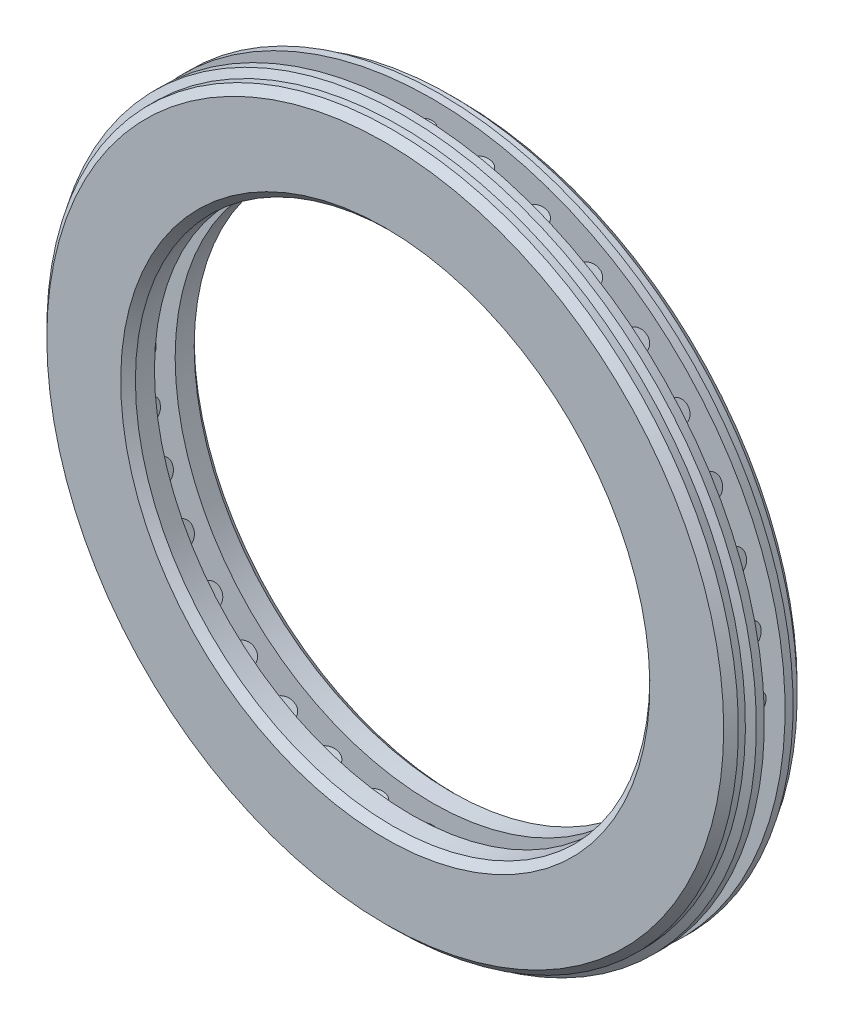
from build123d import *

# Parameters (mm, degrees)
BASESKE_W            = 1.428571429
BASESKE_H            = 7.8
CHAMFER1_SIZE        = 1
CIRPATTERNBALL_COUNT = 36


with BuildPart() as part:
    # BaseSke → Roller (revolve)
    with BuildSketch(Plane(origin=(0, 0, 0), x_dir=(0, 0, -1), z_dir=(1, 0, 0))):
        with Locations((-0.714285715, 41.5)):
            Rectangle(BASESKE_W, BASESKE_H)
    roller = revolve(axis=Axis((0, 129.521395432, 0), (0, -1, 0)))

    # ThrustPSke → ThrustPlates (revolve)
    with BuildSketch(Plane(origin=(0, 0, 0), x_dir=(0, 0, -1), z_dir=(1, 0, 0))):
        Polygon((-2.5, 48), (-1.408571429, 48), (-1.408571429, 35), (-5, 35), (-5, 47.054795131), (-3.045714286, 47.054795131), align=None)
        Polygon((5, 35), (1.408571429, 35), (1.408571429, 48), (2.5, 48), (3.045714286, 47.054795131), (5, 47.054795131), align=None)
    revolve(axis=Axis((0, 0, 10.13372637), (0, 0, -1)))

    # Chamfer1
    chamfer1_edges = [part.edges().sort_by_distance(p)[0] for p in [
        (0, -35, 5),
        (0, -35, -5),
        (0, -47.054795131, 5),
        (0, -47.054795131, -5),
    ]]
    chamfer(chamfer1_edges, length=CHAMFER1_SIZE)

    # CirPatternBall: Roller ×36 about axis
    cirpatternball_axis = Axis((0, 0, 10.13372637), (0, 0, -1))
    for i in range(1, CIRPATTERNBALL_COUNT):
        add(roller.rotate(cirpatternball_axis, i * 360 / CIRPATTERNBALL_COUNT))


solid = part.part
